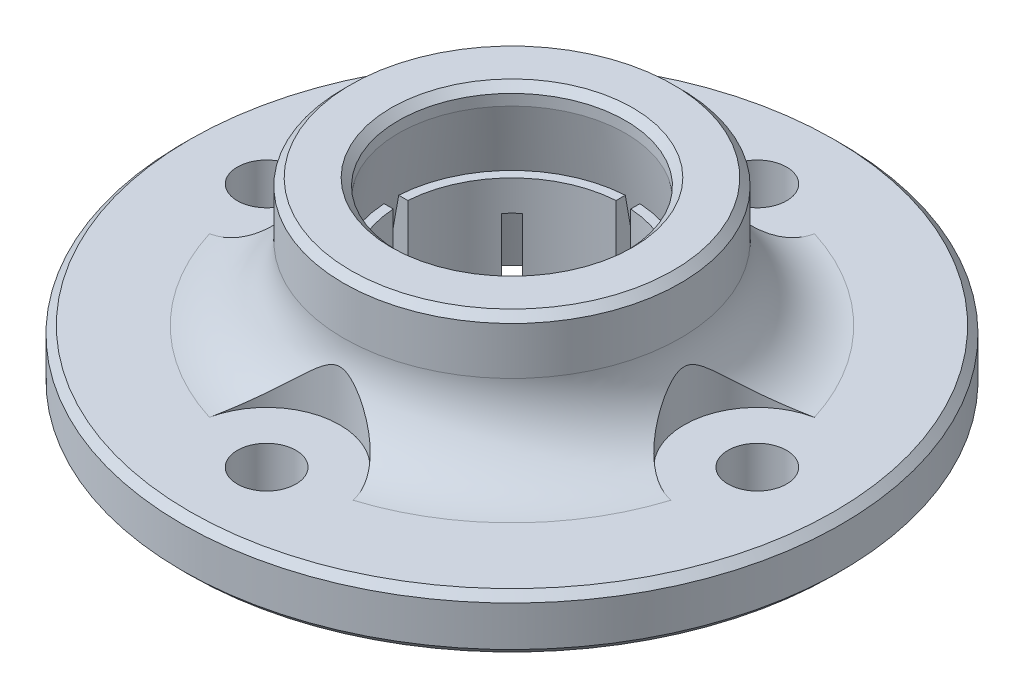
from build123d import *
from OCP.BRepFilletAPI import BRepFilletAPI_MakeChamfer

# Parameters (mm, degrees)
FILLET2_R               = 2
SKETCH5_W               = 0.8
SKETCH5_H               = 1.5
SKETCH9_R               = 2
CUT_EXTRUDE1_DEPTH      = 14.200378782
CIRPATTERN1_COUNT       = 4
SKETCH7_W               = 0.4
SKETCH7_H               = 6
CUT_EXTRUDE_THIN1_DEPTH = 2.5
CUT_EXTRUDE_THIN2_DEPTH = 2.5
CIRPATTERN2_COUNT       = 4
CHAMFER1_SIZE           = 0.2
CHAMFER1_SIZE2          = 0.24656061


with BuildPart() as part:
    # Sketch2 → Revolve1 (revolve)
    with BuildSketch(Plane(origin=(0, 0, 0), x_dir=(0, 0, -1), z_dir=(1, 0, 0))):
        Polygon((-3.1, 5), (-3.1, 4.5), (-3.893471413, 0), (-9, 0), (-9, 1.5), (-4.6, 1.5), (-4.6, 5), align=None)
    revolve(axis=Axis((0, 8.4, 0), (0, -1, 0)))

    # Fillet2
    fillet2_edges = [part.edges().sort_by_distance(p)[0] for p in [
        (0, 1.5, -4.6),
    ]]
    fillet(fillet2_edges, radius=FILLET2_R)

    # Sketch5 → M2x0.4 Tapped Hole1 (revolve, cut)
    with BuildSketch(Plane(origin=(0, 1.5, 6.7), x_dir=(0, 0, 1), z_dir=(1, 0, 0))):
        with Locations((0.4, 0.75)):
            Rectangle(SKETCH5_W, SKETCH5_H)
    m2x0_4_tapped_hole1 = revolve(axis=Axis((0, 7.85, 6.7), (0, -1, 0)), mode=Mode.SUBTRACT)

    # Sketch9 → Cut-Extrude1 (cut, through all)
    with BuildSketch(Plane(origin=(0, 1.5, 0), x_dir=(1, 0, 0), z_dir=(0, 1, 0))):
        with Locations((0, -6.7)):
            Circle(SKETCH9_R)
    cut_extrude1 = extrude(amount=CUT_EXTRUDE1_DEPTH, mode=Mode.SUBTRACT)

    # CirPattern1: M2x0.4 Tapped Hole1, Cut-Extrude1 ×4 about axis
    cirpattern1_axis = Axis((0, 8.4, 0), (0, -1, 0))
    add([m2x0_4_tapped_hole1.rotate(cirpattern1_axis, i * 360 / CIRPATTERN1_COUNT) for i in range(1, CIRPATTERN1_COUNT)], mode=Mode.SUBTRACT)
    add([cut_extrude1.rotate(cirpattern1_axis, i * 360 / CIRPATTERN1_COUNT) for i in range(1, CIRPATTERN1_COUNT)], mode=Mode.SUBTRACT)

    # Chamfer1: one chamfer whose edges measure the first distance from different faces: ONE call of the kernel's chamfer builder (chamfer() names one face for all edges)
    chamfer1_edges_1 = [part.edges().sort_by_distance(p)[0] for p in [
        (0, 0, -3.893471413),
    ]]
    chamfer1_side_1 = [part.faces().sort_by_distance(p)[0] for p in [
        (0, 2.25, -3.496735707),
    ]]
    chamfer1_edges_2 = [part.edges().sort_by_distance(p)[0] for p in [
        (0, 5, -3.1),
        (0, 1.5, -9),
        (0, 5, -4.6),
        (0, 0, -9),
    ]]
    chamfer1 = BRepFilletAPI_MakeChamfer(part.part.solid().wrapped)
    for e in chamfer1_edges_1:
        chamfer1.Add(CHAMFER1_SIZE, CHAMFER1_SIZE2, e.wrapped, chamfer1_side_1[0].wrapped)  # the first distance lies on this face
    for e in chamfer1_edges_2:
        chamfer1.Add(CHAMFER1_SIZE, e.wrapped)
    add(Compound.cast(chamfer1.Shape()), mode=Mode.REPLACE)


with BuildPart() as body_2:
    # Sketch6 → Revolve2 (revolve)
    with BuildSketch(Plane.XY):
        Polygon((3.05, 2.83564091), (3.05, -0.5), (3.8, -0.5), (3.8, 0), (3.3, 2.83564091), align=None)
    revolve(axis=Axis((0, 8.4, 0), (0, -1, 0)))

    # Sketch7 → Cut-Extrude-Thin1 (cut)
    with BuildSketch(Plane(origin=(0, 2.83564091, 0), x_dir=(1, 0, 0), z_dir=(0, 1, 0))):
        with Locations((0, 3)):
            Rectangle(SKETCH7_W, SKETCH7_H)
    cut_extrude_thin1 = extrude(amount=-CUT_EXTRUDE_THIN1_DEPTH, mode=Mode.SUBTRACT)

    # Sketch8 → Cut-Extrude-Thin2 (cut)
    with BuildSketch(Plane.XZ.offset(0.5)):
        Polygon((0.141421356, -0.141421356), (4.384062043, 4.101219331), (4.101219331, 4.384062043), (-0.141421356, 0.141421356), align=None)
    cut_extrude_thin2 = extrude(amount=-CUT_EXTRUDE_THIN2_DEPTH, mode=Mode.SUBTRACT)

    # CirPattern2: Cut-Extrude-Thin1, Cut-Extrude-Thin2 ×4 about axis
    cirpattern2_axis = Axis((0, 8.4, 0), (0, -1, 0))
    add([cut_extrude_thin1.rotate(cirpattern2_axis, i * 360 / CIRPATTERN2_COUNT) for i in range(1, CIRPATTERN2_COUNT)], mode=Mode.SUBTRACT)
    add([cut_extrude_thin2.rotate(cirpattern2_axis, i * 360 / CIRPATTERN2_COUNT) for i in range(1, CIRPATTERN2_COUNT)], mode=Mode.SUBTRACT)


solid = Compound([part.part, body_2.part])
